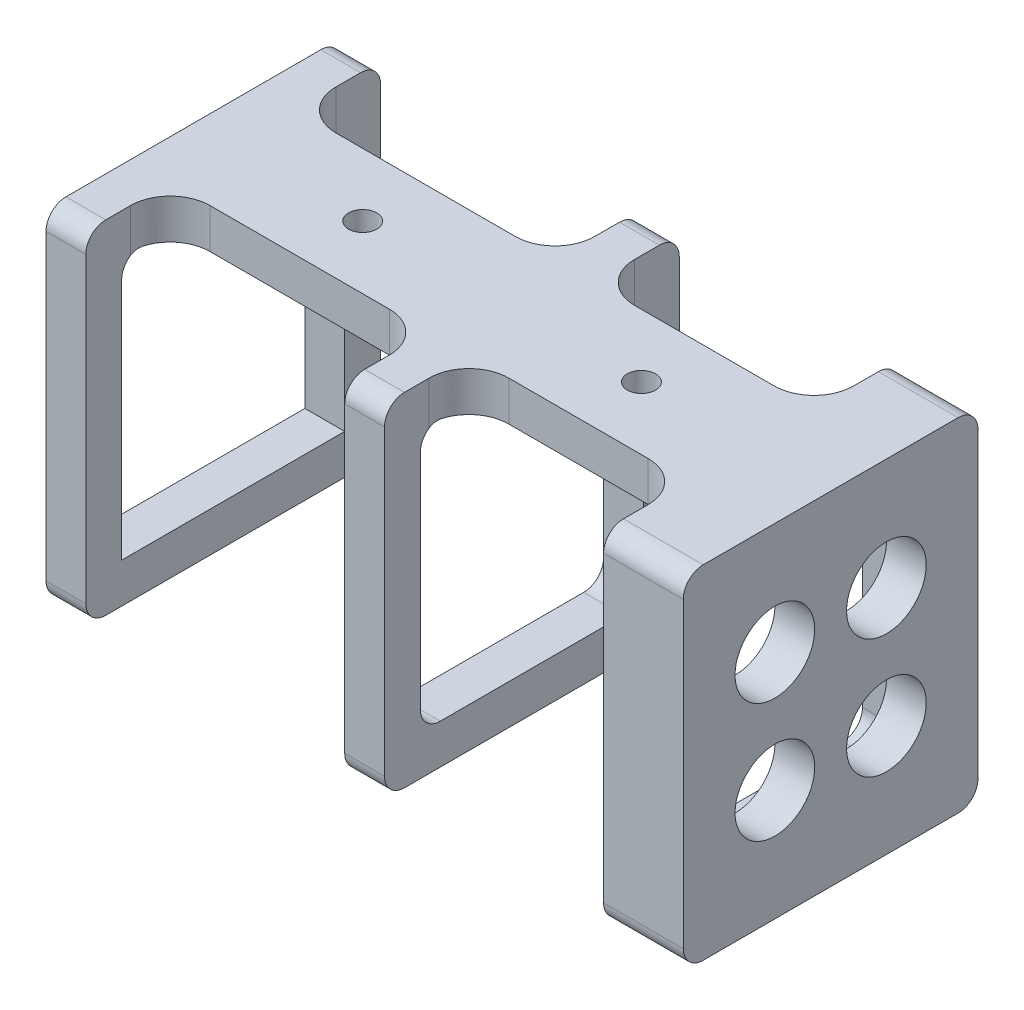
from build123d import *

# Parameters (mm, degrees)
SKETCH1_W           = 101.6
SKETCH1_H           = 20.066
BOSS_EXTRUDE1_DEPTH = 6.35
SKETCH2_W           = 6.35
SKETCH2_H           = 46.99
BOSS_EXTRUDE2_DEPTH = 54.61
SKETCH3_W           = 35.56
SKETCH3_H           = 41.91
CUT_EXTRUDE1_DEPTH  = 77.120583616
BOSS_EXTRUDE3_DEPTH = 6.35
SKETCH5_R           = 6.35
CUT_EXTRUDE2_DEPTH  = 110.33254376
SKETCH6_R           = 2.25
CUT_EXTRUDE3_DEPTH  = 74.903197664
FILLET1_R           = 3.175
FILLET2_R           = 6.35


with BuildPart() as part:
    # Sketch1 → Boss-Extrude1 (new body)
    with BuildSketch(Plane(origin=(0, 0, 0), x_dir=(1, 0, 0), z_dir=(0, 1, 0))):
        Rectangle(SKETCH1_W, SKETCH1_H)
    extrude(amount=BOSS_EXTRUDE1_DEPTH)

    # Sketch2 → Boss-Extrude2 (add)
    with BuildSketch(Plane(origin=(0, 6.35, 0), x_dir=(1, 0, 0), z_dir=(0, 1, 0))):
        with Locations((47.625, 0)):
            Rectangle(SKETCH2_W, SKETCH2_H)
        with Locations((-47.625, 0)):
            Rectangle(SKETCH2_W, SKETCH2_H)
        Rectangle(SKETCH2_W, SKETCH2_H)
    extrude(amount=-BOSS_EXTRUDE2_DEPTH)

    # Sketch3 → Cut-Extrude1 (cut, through all)
    with BuildSketch(Plane(origin=(3.175, 0, 0), x_dir=(0, 0, -1), z_dir=(1, 0, 0))):
        with Locations((0, -20.955)):
            Rectangle(SKETCH3_W, SKETCH3_H)
    extrude(amount=-CUT_EXTRUDE1_DEPTH, mode=Mode.SUBTRACT)

    # Sketch4 → Boss-Extrude3 (add)
    with BuildSketch(Plane.ZY.offset(-44.45)):
        Polygon((10.033, 0), (17.78, 0), (17.78, -41.91), (-17.78, -41.91), (-17.78, 0), (-10.033, 0), (-10.033, 6.35), (-23.495, 6.35), (-23.495, -48.26), (23.495, -48.26), (23.495, 6.35), (10.033, 6.35), align=None)
    extrude(amount=BOSS_EXTRUDE3_DEPTH)

    # Sketch5 → Cut-Extrude2 (cut, through all)
    with BuildSketch(Plane.ZY.offset(-44.45)):
        with Locations((-8.89, -11.43)):
            Circle(SKETCH5_R)
        with Locations((-8.89, -30.48)):
            Circle(SKETCH5_R)
        with Locations((8.89, -30.48)):
            Circle(SKETCH5_R)
        with Locations((8.89, -11.43)):
            Circle(SKETCH5_R)
    extrude(amount=-CUT_EXTRUDE2_DEPTH, mode=Mode.SUBTRACT)

    # Sketch6 → Cut-Extrude3 (cut, through all)
    with BuildSketch(Plane.XZ):
        with Locations((-23.8125, 0)):
            Circle(SKETCH6_R)
        with Locations((20.6375, 0)):
            Circle(SKETCH6_R)
    extrude(amount=-CUT_EXTRUDE3_DEPTH, mode=Mode.SUBTRACT)

    # Fillet1
    fillet1_edges = [part.edges().sort_by_distance(p)[0] for p in [
        (-47.625, 0, -17.78),
        (-47.625, 0, 17.78),
        (0, 0, -17.78),
        (41.275, 0, -17.78),
        (41.275, 0, 17.78),
        (0, 0, 17.78),
        (0, -41.91, -17.78),
        (0, -41.91, 17.78),
        (41.275, -41.91, 17.78),
        (41.275, -41.91, -17.78),
        (44.45, -48.26, -23.495),
        (0, -48.26, -23.495),
        (-47.625, -48.26, -23.495),
        (-47.625, -48.26, 23.495),
        (0, -48.26, 23.495),
        (44.45, -48.26, 23.495),
        (44.45, 6.35, 23.495),
        (-47.625, 6.35, 23.495),
        (44.45, 6.35, -23.495),
        (-47.625, 6.35, -23.495),
        (0, 6.35, -23.495),
        (0, 6.35, 23.495),
    ]]
    fillet(fillet1_edges, radius=FILLET1_R)

    # Fillet2
    fillet2_edges = [part.edges().sort_by_distance(p)[0] for p in [
        (-44.45, 3.175, -10.033),
    ]]
    fillet(fillet2_edges, radius=FILLET2_R)
    fillet2_2_edges = [part.edges().sort_by_distance(p)[0] for p in [
        (-44.45, 3.175, 10.033),
    ]]
    fillet(fillet2_2_edges, radius=FILLET2_R)
    fillet2_3_edges = [part.edges().sort_by_distance(p)[0] for p in [
        (-3.175, 3.175, 10.033),
    ]]
    fillet(fillet2_3_edges, radius=FILLET2_R)
    fillet2_4_edges = [part.edges().sort_by_distance(p)[0] for p in [
        (-3.175, 3.175, -10.033),
    ]]
    fillet(fillet2_4_edges, radius=FILLET2_R)
    fillet2_5_edges = [part.edges().sort_by_distance(p)[0] for p in [
        (3.175, 3.175, -10.033),
    ]]
    fillet(fillet2_5_edges, radius=FILLET2_R)
    fillet2_6_edges = [part.edges().sort_by_distance(p)[0] for p in [
        (3.175, 3.175, 10.033),
    ]]
    fillet(fillet2_6_edges, radius=FILLET2_R)
    fillet2_7_edges = [part.edges().sort_by_distance(p)[0] for p in [
        (38.1, 3.175, 10.033),
    ]]
    fillet(fillet2_7_edges, radius=FILLET2_R)
    fillet2_8_edges = [part.edges().sort_by_distance(p)[0] for p in [
        (38.1, 3.175, -10.033),
    ]]
    fillet(fillet2_8_edges, radius=FILLET2_R)


solid = part.part
